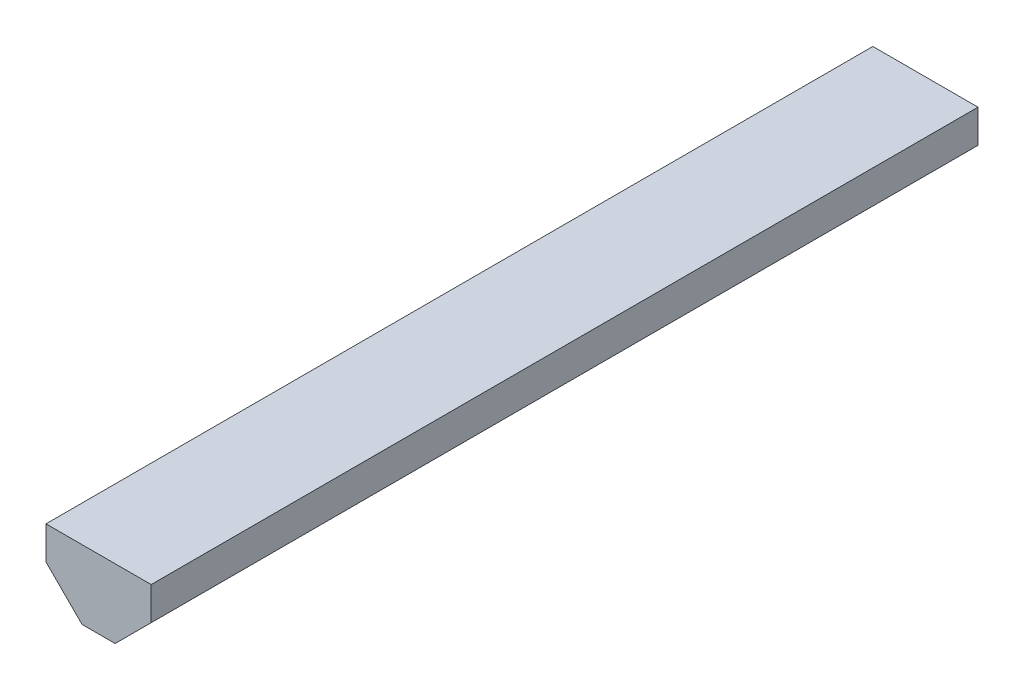
from build123d import *

# Parameters (mm, degrees)
BOSS_EXTRUDE1_DEPTH = 952.5


with BuildPart() as part:
    # Sketch1 → Boss-Extrude1 (new body)
    with BuildSketch(Plane.XY):
        Polygon((19.05, -60.57513929), (-19.05, -60.57513929), (-60.57513929, -19.05), (-60.57513929, 19.05), (60.57513929, 19.05), (60.57513929, -19.05), align=None)
    extrude(amount=BOSS_EXTRUDE1_DEPTH)


solid = part.part
